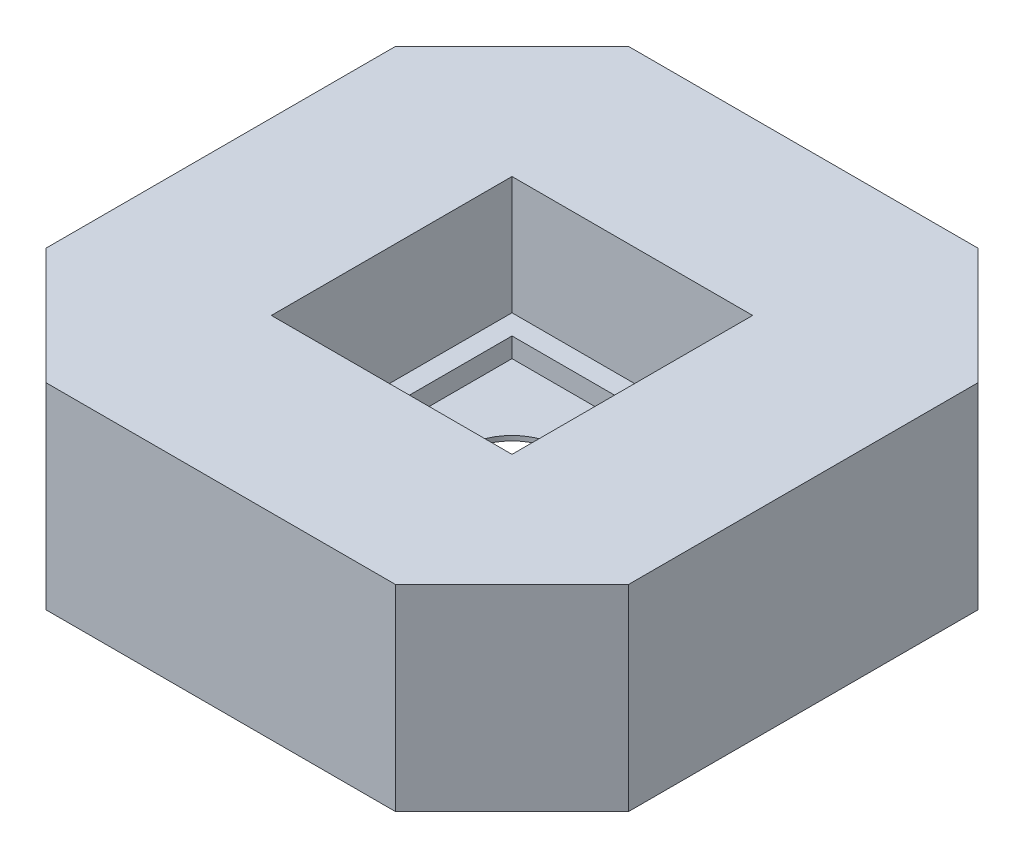
from build123d import *

# Parameters (mm, degrees)
EXTRUDE_1_DEPTH                    = 206
SKETCH_4_W                         = 252
SKETCH_4_H                         = 252
CUT_EXTRUDE_3_DEPTH                = 123.6
SKETCH_5_W                         = 210
SKETCH_5_H                         = 210
CUT_EXTRUDE_5_DEPTH                = 144.2
SHELL_10_T                         = -5
SKETCH_6_R                         = 50
CUT_EXTRUDE_6_DEPTH                = 455.80065963
RIB_2_REACH                        = 542.993
SKETCH_11_WALL_W                   = 1255.59277199
SKETCH_11_WALL_H                   = 10
PATTERN_CIRCULAR_1_COPY_1_REACH    = 542.993
PATTERN_CIRCULAR_1_COPY_1_SKETCH_W = 1255.59277199
PATTERN_CIRCULAR_1_COPY_1_SKETCH_H = 10
PATTERN_CIRCULAR_1_COPY_2_REACH    = 542.993
PATTERN_CIRCULAR_1_COPY_2_SKETCH_W = 1255.59277199
PATTERN_CIRCULAR_1_COPY_2_SKETCH_H = 10
PATTERN_CIRCULAR_1_COPY_3_REACH    = 542.993
PATTERN_CIRCULAR_1_COPY_3_SKETCH_W = 1255.59277199
PATTERN_CIRCULAR_1_COPY_3_SKETCH_H = 10
PATTERN_CIRCULAR_1_COPY_4_REACH    = 542.993
PATTERN_CIRCULAR_1_COPY_4_SKETCH_W = 1255.59277199
PATTERN_CIRCULAR_1_COPY_4_SKETCH_H = 10
PATTERN_CIRCULAR_1_COPY_5_REACH    = 542.993
PATTERN_CIRCULAR_1_COPY_5_SKETCH_W = 1255.59277199
PATTERN_CIRCULAR_1_COPY_5_SKETCH_H = 10
PATTERN_CIRCULAR_1_COPY_6_REACH    = 542.993
PATTERN_CIRCULAR_1_COPY_6_SKETCH_W = 1255.59277199
PATTERN_CIRCULAR_1_COPY_6_SKETCH_H = 10


with BuildPart() as part:
    # 草图1 → 凸台-拉伸1 (new body)
    with BuildSketch(Plane(origin=(0, 0, 0), x_dir=(1, 0, 0), z_dir=(0, 1, 0))):
        Polygon((-305, 183), (-183, 305), (183, 305), (305, 183), (305, -183), (183, -305), (-183, -305), (-305, -183), align=None)
    extrude(amount=EXTRUDE_1_DEPTH)

    # 草图4 → 切除-拉伸3 (cut)
    with BuildSketch(Plane(origin=(0, 206, 0), x_dir=(1, 0, 0), z_dir=(0, 1, 0))):
        Rectangle(SKETCH_4_W, SKETCH_4_H)
    extrude(amount=-CUT_EXTRUDE_3_DEPTH, mode=Mode.SUBTRACT)

    # 草图5 → 切除-拉伸5 (cut)
    with BuildSketch(Plane(origin=(0, 206, 0), x_dir=(1, 0, 0), z_dir=(0, 1, 0))):
        Rectangle(SKETCH_5_W, SKETCH_5_H)
    extrude(amount=-CUT_EXTRUDE_5_DEPTH, mode=Mode.SUBTRACT)

    # 抽壳10
    shell_10_openings = [part.faces().sort_by_distance(p)[0] for p in [
        (0, 0, 0),
    ]]
    offset(amount=SHELL_10_T, openings=shell_10_openings, kind=Kind.INTERSECTION)

    # 草图6 → 切除-拉伸6 (cut, through all)
    with BuildSketch(Plane(origin=(0, 61.8, 0), x_dir=(1, 0, 0), z_dir=(0, 1, 0))):
        Circle(SKETCH_6_R)
    extrude(amount=-CUT_EXTRUDE_6_DEPTH, mode=Mode.SUBTRACT)

    # 草图11 wall → 筋2 (add, up to next)
    with BuildSketch(Plane(origin=(91.5, 97.29962987, 215.5), x_dir=(0, 0.173648177668, 0.984807753012), z_dir=(0, -0.984807753012, 0.173648177668)), mode=Mode.PRIVATE) as rib_2_sk1:
        Rectangle(SKETCH_11_WALL_W, SKETCH_11_WALL_H)
    rib_2_tool1 = extrude(rib_2_sk1.sketch, amount=-RIB_2_REACH, mode=Mode.PRIVATE) - part.part
    rib_2 = rib_2_tool1.solids().sort_by_distance((91.5, 97.29962987, 215.5))[0]
    add(rib_2)

    # 镜向1: 筋2 across plane
    add(rib_2.mirror(Plane(origin=(0, 0, 0), x_dir=(0, 0, 1), z_dir=(1, 0, 0))))

    # 阵列(圆周)1 copy 1 sketch → 阵列(圆周)1 copy 1 (add, up to next)
    with BuildSketch(Plane(origin=(215.5, 97.29962987, 91.5), x_dir=(0.984807753012, 0.173648177668, 0), z_dir=(0.173648177668, -0.984807753012, 0)), mode=Mode.PRIVATE) as pattern_circular_1_copy_1_sk1:
        Rectangle(PATTERN_CIRCULAR_1_COPY_1_SKETCH_W, PATTERN_CIRCULAR_1_COPY_1_SKETCH_H)
    pattern_circular_1_copy_1_tool1 = extrude(pattern_circular_1_copy_1_sk1.sketch, amount=-PATTERN_CIRCULAR_1_COPY_1_REACH, mode=Mode.PRIVATE) - part.part
    add(pattern_circular_1_copy_1_tool1.solids().sort_by_distance((215.5, 97.29962987, 91.5))[0])

    # 阵列(圆周)1 copy 2 sketch → 阵列(圆周)1 copy 2 (add, up to next)
    with BuildSketch(Plane(origin=(91.5, 97.29962987, -215.5), x_dir=(0, 0.173648177668, -0.984807753012), z_dir=(0, -0.984807753012, -0.173648177668)), mode=Mode.PRIVATE) as pattern_circular_1_copy_2_sk1:
        Rectangle(PATTERN_CIRCULAR_1_COPY_2_SKETCH_W, PATTERN_CIRCULAR_1_COPY_2_SKETCH_H)
    pattern_circular_1_copy_2_tool1 = extrude(pattern_circular_1_copy_2_sk1.sketch, amount=-PATTERN_CIRCULAR_1_COPY_2_REACH, mode=Mode.PRIVATE) - part.part
    add(pattern_circular_1_copy_2_tool1.solids().sort_by_distance((91.5, 97.29962987, -215.5))[0])

    # 阵列(圆周)1 copy 3 sketch → 阵列(圆周)1 copy 3 (add, up to next)
    with BuildSketch(Plane(origin=(-215.5, 97.29962987, -91.5), x_dir=(-0.984807753012, 0.173648177668, 0), z_dir=(-0.173648177668, -0.984807753012, 0)), mode=Mode.PRIVATE) as pattern_circular_1_copy_3_sk1:
        Rectangle(PATTERN_CIRCULAR_1_COPY_3_SKETCH_W, PATTERN_CIRCULAR_1_COPY_3_SKETCH_H)
    pattern_circular_1_copy_3_tool1 = extrude(pattern_circular_1_copy_3_sk1.sketch, amount=-PATTERN_CIRCULAR_1_COPY_3_REACH, mode=Mode.PRIVATE) - part.part
    add(pattern_circular_1_copy_3_tool1.solids().sort_by_distance((-215.5, 97.29962987, -91.5))[0])

    # 阵列(圆周)1 copy 4 sketch → 阵列(圆周)1 copy 4 (add, up to next)
    with BuildSketch(Plane(origin=(215.5, 97.29962987, -91.5), x_dir=(0.984807753012, 0.173648177668, 0), z_dir=(0.173648177668, -0.984807753012, 0)), mode=Mode.PRIVATE) as pattern_circular_1_copy_4_sk1:
        Rectangle(PATTERN_CIRCULAR_1_COPY_4_SKETCH_W, PATTERN_CIRCULAR_1_COPY_4_SKETCH_H)
    pattern_circular_1_copy_4_tool1 = extrude(pattern_circular_1_copy_4_sk1.sketch, amount=-PATTERN_CIRCULAR_1_COPY_4_REACH, mode=Mode.PRIVATE) - part.part
    add(pattern_circular_1_copy_4_tool1.solids().sort_by_distance((215.5, 97.29962987, -91.5))[0])

    # 阵列(圆周)1 copy 5 sketch → 阵列(圆周)1 copy 5 (add, up to next)
    with BuildSketch(Plane(origin=(-91.5, 97.29962987, -215.5), x_dir=(0, 0.173648177668, -0.984807753012), z_dir=(0, -0.984807753012, -0.173648177668)), mode=Mode.PRIVATE) as pattern_circular_1_copy_5_sk1:
        Rectangle(PATTERN_CIRCULAR_1_COPY_5_SKETCH_W, PATTERN_CIRCULAR_1_COPY_5_SKETCH_H)
    pattern_circular_1_copy_5_tool1 = extrude(pattern_circular_1_copy_5_sk1.sketch, amount=-PATTERN_CIRCULAR_1_COPY_5_REACH, mode=Mode.PRIVATE) - part.part
    add(pattern_circular_1_copy_5_tool1.solids().sort_by_distance((-91.5, 97.29962987, -215.5))[0])

    # 阵列(圆周)1 copy 6 sketch → 阵列(圆周)1 copy 6 (add, up to next)
    with BuildSketch(Plane(origin=(-215.5, 97.29962987, 91.5), x_dir=(-0.984807753012, 0.173648177668, 0), z_dir=(-0.173648177668, -0.984807753012, 0)), mode=Mode.PRIVATE) as pattern_circular_1_copy_6_sk1:
        Rectangle(PATTERN_CIRCULAR_1_COPY_6_SKETCH_W, PATTERN_CIRCULAR_1_COPY_6_SKETCH_H)
    pattern_circular_1_copy_6_tool1 = extrude(pattern_circular_1_copy_6_sk1.sketch, amount=-PATTERN_CIRCULAR_1_COPY_6_REACH, mode=Mode.PRIVATE) - part.part
    add(pattern_circular_1_copy_6_tool1.solids().sort_by_distance((-215.5, 97.29962987, 91.5))[0])


solid = part.part
